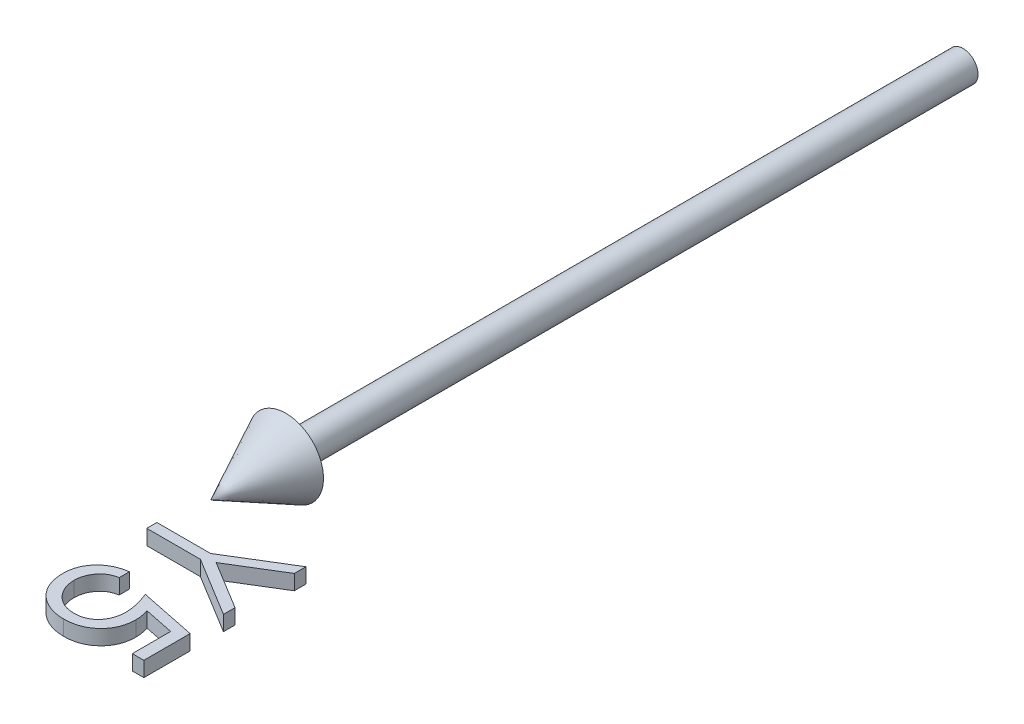
from build123d import *

# Parameters (mm, degrees)
BOSS_EXTRUDE1_DEPTH        = 1
BOSS_EXTRUDE1_DEPTH_BACK   = 1
BOSS_EXTRUDE1_2_DEPTH      = 1
BOSS_EXTRUDE1_2_DEPTH_BACK = 1


with BuildPart() as part:
    # Sketch2 → Revolve1 (revolve)
    with BuildSketch(Plane(origin=(0, 0, 0), x_dir=(1, 0, 0), z_dir=(0, 1, 0))):
        Polygon((0, -100), (5, -90), (2, -90), (2, 0), (0, 0), align=None)
    revolve(axis=Axis((0, 0, -41.949952025), (0, 0, 1)))


with BuildPart() as body_2:
    # Sketch3 → Boss-Extrude1 (new, two sides: drawn at the far end of the back side and taken through both)
    with BuildSketch(Plane(origin=(0, 0, 0), x_dir=(1, 0, 0), z_dir=(0, 1, 0)).offset(-BOSS_EXTRUDE1_DEPTH_BACK)):
        Polygon((15, -102.339799406), (15, -103.881265752), (8.5546875, -107.823573444), (15, -111.759871521), (15, -113.301337867), (7.130408654, -108.49364556), (0, -108.49364556), (0, -107.147491713), (7.130408654, -107.147491713), align=None)
    extrude(amount=BOSS_EXTRUDE1_DEPTH + BOSS_EXTRUDE1_DEPTH_BACK)


with BuildPart() as body_3:
    # Sketch3 → Boss-Extrude1 2 (new, two sides: drawn at the far end of the back side and taken through both)
    with BuildSketch(Plane(origin=(0, 0, 0), x_dir=(1, 0, 0), z_dir=(0, 1, 0)).offset(-BOSS_EXTRUDE1_2_DEPTH_BACK)):
        with BuildLine():
            Line((15, -123.878260944), (13.461538462, -123.878260944))
            Line((13.461538462, -123.878260944), (13.461538462, -118.776097483))
            Line((13.461538462, -118.776097483), (9.516225962, -117.967804213))
            add(Edge.make_bspline(
                [(9.516225962, -117.967804213), (9.560069984, -118.126615104), (9.645010842, -118.434286086), (9.739321287, -118.888399776), (9.79617319, -119.319509219), (9.803935949, -119.599260807), (9.807692308, -119.734631137)],
                knots=[0, 0, 0, 0, 1.100273476, 2.13160584, 3.095893838, 4, 4, 4, 4], degree=3))
            add(Edge.make_bspline(
                [(9.807692308, -119.734631137), (9.80406592, -119.9021323), (9.796935536, -120.231481438), (9.728498237, -120.713370853), (9.620706778, -121.173339138), (9.470367987, -121.610600417), (9.27688397, -122.026096505), (9.038322224, -122.417507079), (8.756332859, -122.787050407), (8.433636595, -123.12984127), (8.078046752, -123.440338797), (7.69696552, -123.714415932), (7.29004627, -123.942359656), (6.859088372, -124.129892379), (6.40481492, -124.278681485), (5.923863394, -124.377983997), (5.420501794, -124.444033574), (5.07634109, -124.451418292), (4.900841346, -124.455184021)],
                knots=[0, 0, 0, 0, 1.052772836, 2.070014431, 3.053871312, 4.019926262, 4.972333346, 5.930471369, 6.896690565, 7.89035727, 8.885779078, 9.861050232, 10.836829716, 11.812751485, 12.812646763, 13.836748493, 14.896881366, 16, 16, 16, 16], degree=3))
            add(Edge.make_bspline(
                [(4.900841346, -124.455184021), (4.778603099, -124.452334082), (4.535778548, -124.44667272), (4.175162896, -124.417873144), (3.82217058, -124.3624553), (3.476806888, -124.287944925), (3.139533541, -124.191619233), (2.810473221, -124.073743647), (2.488612692, -123.934797391), (2.173930875, -123.777923774), (1.876128909, -123.596450075), (1.590609774, -123.405288711), (1.327881174, -123.193534537), (1.078351765, -122.971439639), (0.851820957, -122.730123354), (0.638594518, -122.477075758), (0.447934566, -122.20635845), (0.272570453, -121.92281828), (0.115556237, -121.626634043), (-0.015421666, -121.314802493), (-0.130224929, -120.994169148), (-0.223583551, -120.661876235), (-0.296016348, -120.318567507), (-0.3453421, -119.963060756), (-0.381230877, -119.59713985), (-0.383479521, -119.349104594), (-0.384615385, -119.223813829)],
                knots=[0, 0, 0, 0, 1.05623316, 2.098192244, 3.122504159, 4.140841222, 5.148757784, 6.150489607, 7.158294732, 8.176043417, 9.185147859, 10.169157858, 11.142149047, 12.097904048, 13.0527185, 13.998867679, 14.954465986, 15.910220987, 16.877849176, 17.847023716, 18.829548819, 19.818454515, 20.826519638, 21.858115382, 22.918063636, 24, 24, 24, 24], degree=3))
            add(Edge.make_bspline(
                [(-0.384615385, -119.223813829), (-0.381654391, -119.074353237), (-0.375828986, -118.78030718), (-0.314896318, -118.349502142), (-0.227608888, -117.935020499), (-0.096359784, -117.540142507), (0.068338734, -117.161536574), (0.275171288, -116.804242668), (0.512831306, -116.461238012), (0.789518858, -116.14184507), (1.094777245, -115.846011366), (1.4224906, -115.577124228), (1.773961963, -115.341311817), (2.146199136, -115.137611802), (2.539842613, -114.964109604), (2.956070317, -114.827742897), (3.392788381, -114.717697396), (3.693445765, -114.671139247), (3.846153846, -114.647491713)],
                knots=[0, 0, 0, 0, 1.046825758, 2.059506013, 3.044032586, 4.011925612, 4.970610144, 5.93275819, 6.900651216, 7.891265644, 8.889116719, 9.876966323, 10.858259055, 11.851035124, 12.847502422, 13.86866322, 14.9174643, 16, 16, 16, 16], degree=3))
            Line((3.846153846, -114.647491713), (3.846153846, -115.99364556))
            add(Edge.make_bspline(
                [(3.846153846, -115.99364556), (3.703098259, -116.026747103), (3.428137478, -116.090370106), (3.04204192, -116.230386438), (2.69668325, -116.400526842), (2.391735429, -116.607444766), (2.12441618, -116.849281604), (1.88413982, -117.123261965), (1.670243081, -117.433289056), (1.490802042, -117.777665244), (1.337990992, -118.141195473), (1.236183362, -118.521614232), (1.164611935, -118.908636032), (1.157446733, -119.17040005), (1.153846154, -119.301938829)],
                knots=[0, 0, 0, 0, 1.136389429, 2.184203582, 3.172920998, 4.111012962, 5.028380909, 5.957351669, 6.927793475, 7.937618031, 8.960409703, 9.974842029, 10.982339866, 12, 12, 12, 12], degree=3))
            add(Edge.make_bspline(
                [(1.153846154, -119.301938829), (1.157363773, -119.430332162), (1.164289995, -119.683139686), (1.217600047, -120.055188486), (1.299703924, -120.414386518), (1.422574731, -120.757189476), (1.571909239, -121.089596074), (1.763545278, -121.403197947), (1.984088214, -121.707067421), (2.236759486, -121.991759421), (2.515201034, -122.252499918), (2.812961292, -122.482883295), (3.13060492, -122.674784352), (3.462632718, -122.836501962), (3.812683677, -122.959301814), (4.179117285, -123.046906019), (4.562838629, -123.0983477), (4.824564242, -123.105424185), (4.957932692, -123.109030175)],
                knots=[0, 0, 0, 0, 1.027316725, 2.022795036, 3.002884548, 3.971462791, 4.93288096, 5.914575861, 6.907176829, 7.935150275, 8.956128384, 9.956726525, 10.942570165, 11.921478529, 12.907843606, 13.90538589, 14.932640048, 16, 16, 16, 16], degree=3))
            add(Edge.make_bspline(
                [(4.957932692, -123.109030175), (5.078329844, -123.106662661), (5.314125191, -123.102025934), (5.657578768, -123.050500514), (5.984910027, -122.978321396), (6.29319175, -122.867499569), (6.58693828, -122.730569795), (6.859862365, -122.556848003), (7.118975898, -122.3582661), (7.353752503, -122.125671766), (7.571902904, -121.87203753), (7.757597535, -121.591475686), (7.913889203, -121.290385634), (8.048747155, -120.972252173), (8.14560886, -120.629547309), (8.218327983, -120.269046935), (8.260393931, -119.886861189), (8.26623058, -119.62555822), (8.269230769, -119.491241713)],
                knots=[0, 0, 0, 0, 1.045726679, 2.048034203, 3.01323695, 3.95502507, 4.889743367, 5.8246644, 6.761650845, 7.722168973, 8.692072792, 9.66525385, 10.638902184, 11.638179751, 12.663148338, 13.728659964, 14.832472288, 16, 16, 16, 16], degree=3))
            add(Edge.make_bspline(
                [(8.269230769, -119.491241713), (8.266827016, -119.373965187), (8.26190616, -119.13388193), (8.223180046, -118.764754333), (8.163603645, -118.378544617), (8.07773504, -117.973753396), (7.970221633, -117.551491547), (7.835950868, -117.111056844), (7.68128788, -116.652438646), (7.561325997, -116.343755759), (7.5, -116.185953252)],
                knots=[0, 0, 0, 0, 0.824638674, 1.688163388, 2.607705698, 3.571998603, 4.597075385, 5.671199175, 6.809488238, 8, 8, 8, 8], degree=3))
            Line((7.5, -116.185953252), (15, -117.72441479))
            Line((15, -117.72441479), (15, -123.878260944))
        make_face()
    extrude(amount=BOSS_EXTRUDE1_2_DEPTH + BOSS_EXTRUDE1_2_DEPTH_BACK)


solid = Compound([part.part, body_2.part, body_3.part])
